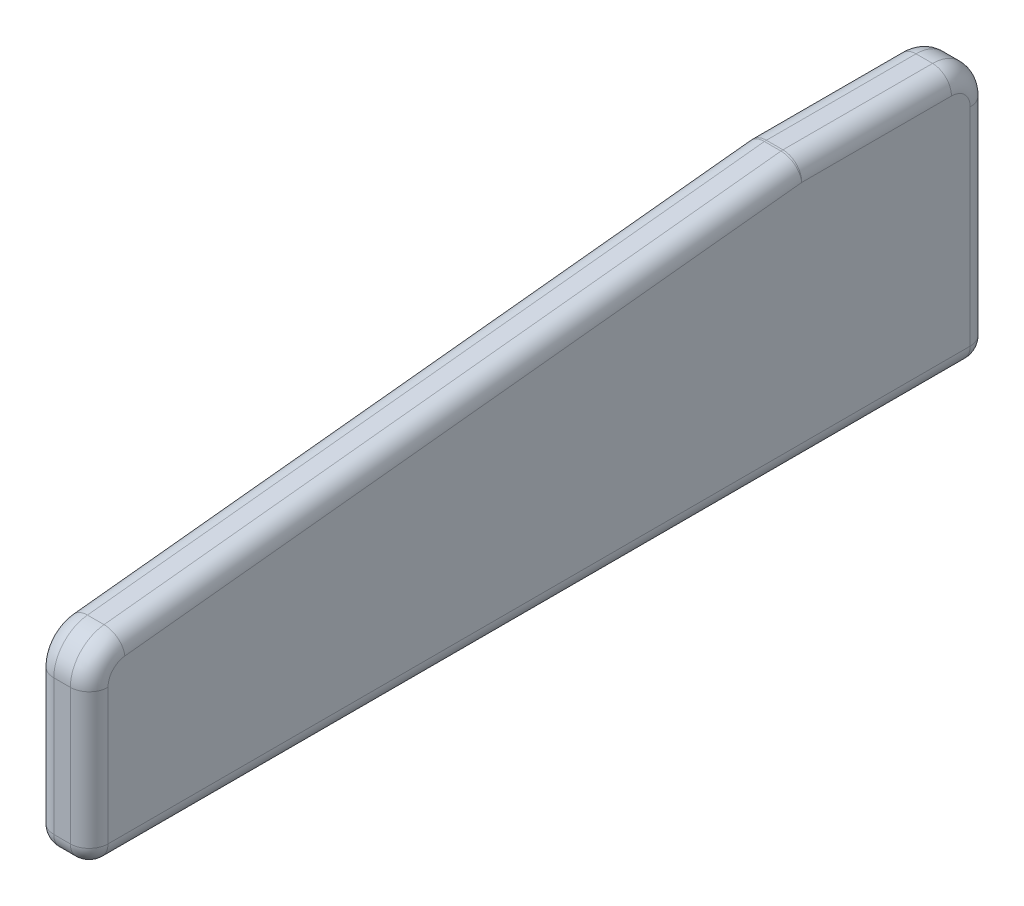
from build123d import *

# Parameters (mm, degrees)
BOSS_EXTRUDE1_DEPTH = 18.288
FILLET1_R           = 6.35


with BuildPart() as part:
    # Sketch1 → Boss-Extrude1 (new body)
    with BuildSketch(Plane(origin=(0, 0, 0), x_dir=(0, 0, -1), z_dir=(1, 0, 0))):
        with BuildLine():
            Line((-166.973473818, -57.646230654), (123.785960254, -57.646230654))
            ThreePointArc((123.785960254, -57.646230654), (128.276088314, -55.786358715), (130.135960254, -51.296230654))
            Line((130.135960254, -51.296230654), (130.135960254, 18.553769346))
            ThreePointArc((130.135960254, 18.553769346), (126.416216375, 27.534025467), (117.435960254, 31.253769346))
            Line((117.435960254, 31.253769346), (66.971101736, 31.253769346))
            ThreePointArc((66.971101736, 31.253769346), (66.636426055, 31.2449437), (66.302680683, 31.218491295))
            Line((66.302680683, 31.218491295), (-161.960315923, 7.056573527))
            ThreePointArc((-161.960315923, 7.056573527), (-170.064551477, 2.921601515), (-173.323473818, -5.572870372))
            Line((-173.323473818, -5.572870372), (-173.323473818, -51.296230654))
            ThreePointArc((-173.323473818, -51.296230654), (-171.463601879, -55.786358715), (-166.973473818, -57.646230654))
        make_face()
    extrude(amount=BOSS_EXTRUDE1_DEPTH)

    # Fillet1
    fillet1_edges = [part.edges().sort_by_distance(p)[0] for p in [
        (0, 27.534025467, -126.416216375),
        (0, -16.371230654, -130.135960254),
        (0, -55.786358715, -128.276088314),
        (0, -57.646230654, 21.593756782),
        (0, -55.786358715, 171.463601879),
        (0, -28.434550513, 173.323473818),
        (0, 2.921601515, 170.064551477),
        (0, 19.137532411, 47.82881762),
        (0, 31.2449437, -66.636426055),
        (18.288, 31.2449437, -66.636426055),
        (18.288, 31.253769346, -92.203530995),
        (18.288, 27.534025467, -126.416216375),
        (18.288, -16.371230654, -130.135960254),
        (18.288, -55.786358715, -128.276088314),
        (18.288, -57.646230654, 21.593756782),
        (18.288, -55.786358715, 171.463601879),
        (18.288, -28.434550513, 173.323473818),
        (18.288, 2.921601515, 170.064551477),
        (0, 31.253769346, -92.203530995),
        (18.288, 19.137532411, 47.82881762),
    ]]
    fillet(fillet1_edges, radius=FILLET1_R)


solid = part.part
